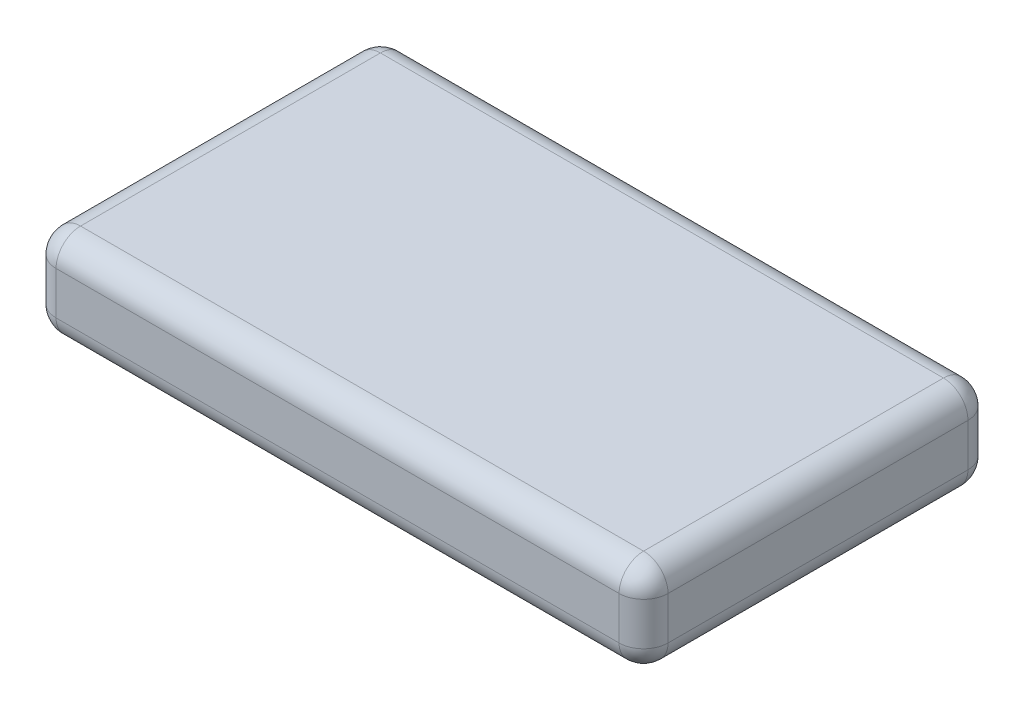
from build123d import *

# Parameters (mm, degrees)
SKETCH1_W           = 50
SKETCH1_H           = 28.5
BOSS_EXTRUDE1_DEPTH = 7.5
FILLET1_R           = 2


with BuildPart() as part:
    # Sketch1 → Boss-Extrude1 (new body)
    with BuildSketch(Plane(origin=(0, 0, 0), x_dir=(1, 0, 0), z_dir=(0, 1, 0))):
        Rectangle(SKETCH1_W, SKETCH1_H)
    extrude(amount=BOSS_EXTRUDE1_DEPTH)

    # Fillet1
    fillet1_edges = [part.edges().sort_by_distance(p)[0] for p in [
        (25, 3.75, -14.25),
        (-25, 3.75, -14.25),
        (0, 0, -14.25),
        (-25, 0, 0),
        (25, 0, 0),
        (-25, 3.75, 14.25),
        (25, 3.75, 14.25),
        (0, 0, 14.25),
        (0, 7.5, 14.25),
        (-25, 7.5, 0),
        (0, 7.5, -14.25),
        (25, 7.5, 0),
    ]]
    fillet(fillet1_edges, radius=FILLET1_R)


solid = part.part
